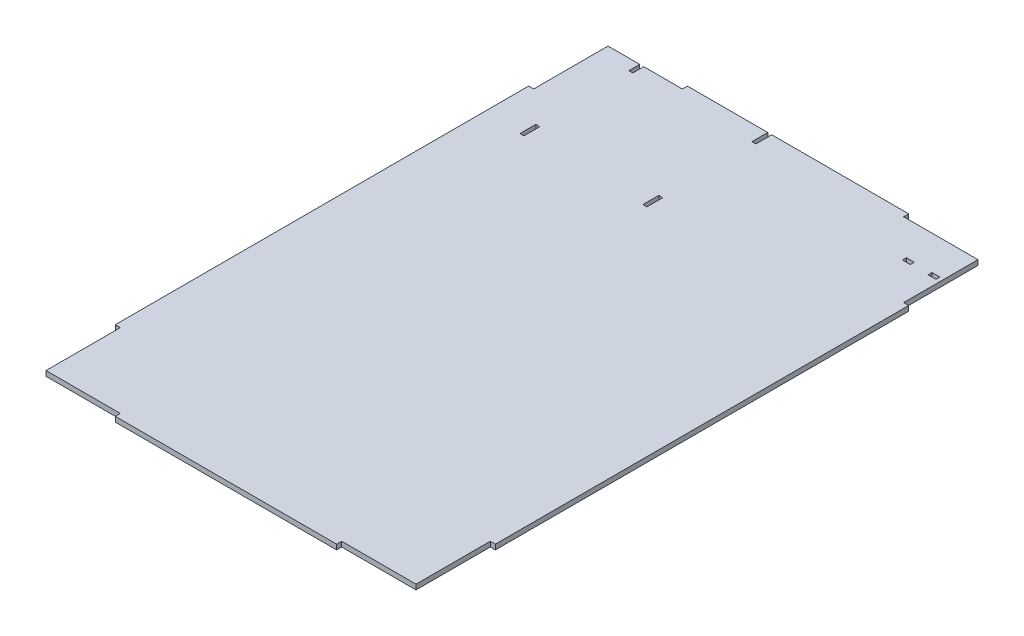
from build123d import *

# Parameters (mm, degrees)
SKETCH1_W           = 479
SKETCH1_H           = 721
BOSS_EXTRUDE1_DEPTH = 3.175
CUT_EXTRUDE1_DEPTH  = 433.851963724
SKETCH3_W           = 5
SKETCH3_H           = 20
SKETCH3_W_2         = 10
SKETCH3_H_2         = 5
CUT_EXTRUDE2_DEPTH  = 433.851963724


with BuildPart() as part:
    # Sketch1 → Boss-Extrude1 (new, symmetric)
    with BuildSketch(Plane(origin=(0, 0, 0), x_dir=(1, 0, 0), z_dir=(0, 1, 0))):
        Rectangle(SKETCH1_W, SKETCH1_H)
    extrude(amount=BOSS_EXTRUDE1_DEPTH, both=True)

    # Sketch2 → Cut-Extrude1 (cut, through all)
    with BuildSketch(Plane(origin=(0, 3.175, 0), x_dir=(1, 0, 0), z_dir=(0, 1, 0))):
        Polygon((-239.5, 360.5), (-239.5, 260.5), (-233.15, 260.5), (-233.15, 354.15), (-139.5, 354.15), (-139.5, 360.5), align=None)
        Polygon((239.5, 360.5), (139.5, 360.5), (139.5, 354.15), (233.15, 354.15), (233.15, 260.5), (239.5, 260.5), align=None)
        Polygon((239.5, -360.5), (239.5, -260.5), (233.15, -260.5), (233.15, -354.15), (139.5, -354.15), (139.5, -360.5), align=None)
        Polygon((-239.5, -360.5), (-139.5, -360.5), (-139.5, -354.15), (-233.15, -354.15), (-233.15, -260.5), (-239.5, -260.5), align=None)
    extrude(amount=-CUT_EXTRUDE1_DEPTH, mode=Mode.SUBTRACT)

    # Sketch3 → Cut-Extrude2 (cut, through all)
    with BuildSketch(Plane.XZ.offset(3.175)):
        with Locations((-35.65, -350.5)):
            Rectangle(SKETCH3_W, SKETCH3_H)
        with Locations((190.85, -308.65)):
            Rectangle(SKETCH3_W_2, SKETCH3_H_2)
        with Locations((223.15, -308.65)):
            Rectangle(SKETCH3_W_2, SKETCH3_H_2)
        with Locations((-190.65, -350.5)):
            Rectangle(SKETCH3_W, SKETCH3_H)
        with Locations((-35.65, -213.15)):
            Rectangle(SKETCH3_W, SKETCH3_H)
        with Locations((-190.65, -213.15)):
            Rectangle(SKETCH3_W, SKETCH3_H)
    extrude(amount=-CUT_EXTRUDE2_DEPTH, mode=Mode.SUBTRACT)


solid = part.part
